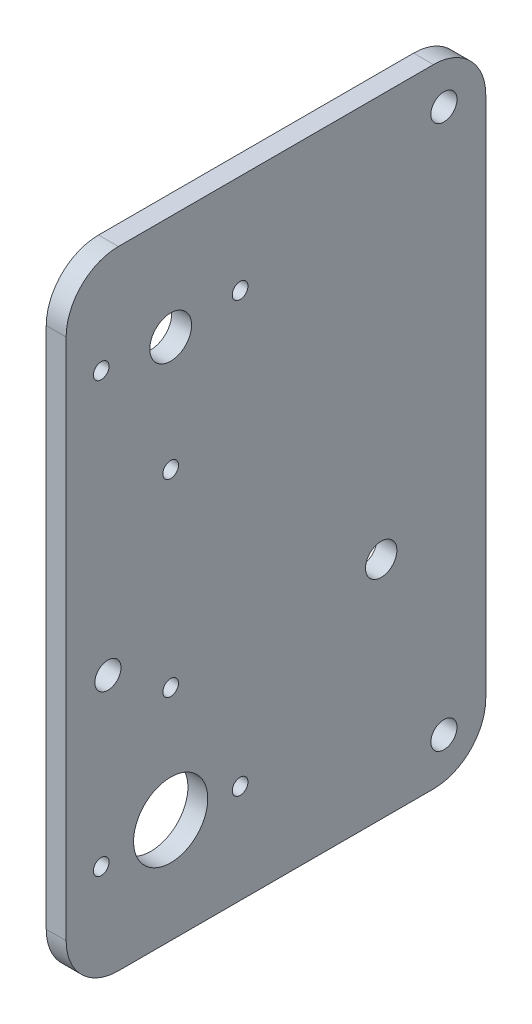
from build123d import *

# Parameters (mm, degrees)
SKETCH1_W           = 80.27017547
SKETCH1_H           = 120
SKETCH1_R           = 4
SKETCH1_R_2         = 7.1
SKETCH1_R_3         = 3
SKETCH1_R_4         = 2.5
SKETCH1_R_5         = 1.5
BOSS_EXTRUDE1_DEPTH = 3.8
FILLET1_R           = 10


with BuildPart() as part:
    # Sketch1 → Boss-Extrude1 (new body)
    with BuildSketch(Plane(origin=(0, 0, 0), x_dir=(0, 0, -1), z_dir=(1, 0, 0))):
        with Locations((22.195139842, -58.413555688)):
            Rectangle(SKETCH1_W, SKETCH1_H)
        with Locations((2.060052107, -18.413555688)):
            Circle(SKETCH1_R, mode=Mode.SUBTRACT)
        with Locations((2.060052107, -98.413555688)):
            Circle(SKETCH1_R_2, mode=Mode.SUBTRACT)
        with Locations((42.330227577, -75.364196313)):
            Circle(SKETCH1_R_3, mode=Mode.SUBTRACT)
        with Locations((54.330227577, -6.413555688)):
            Circle(SKETCH1_R_4, mode=Mode.SUBTRACT)
        with Locations((54.330227577, -110.413555688)):
            Circle(SKETCH1_R_4, mode=Mode.SUBTRACT)
        with Locations((-9.939947893, -68.413555688)):
            Circle(SKETCH1_R_4, mode=Mode.SUBTRACT)
        with Locations((2.060052107, -76.472881174)):
            Circle(SKETCH1_R_5, mode=Mode.SUBTRACT)
        with Locations((-11.225361719, -99.483892921)):
            Circle(SKETCH1_R_5, mode=Mode.SUBTRACT)
        with Locations((15.345465933, -99.483892921)):
            Circle(SKETCH1_R_5, mode=Mode.SUBTRACT)
        with Locations((15.345465933, -17.343218455)):
            Circle(SKETCH1_R_5, mode=Mode.SUBTRACT)
        with Locations((2.060052107, -40.354230201)):
            Circle(SKETCH1_R_5, mode=Mode.SUBTRACT)
        with Locations((-11.225361719, -17.343218455)):
            Circle(SKETCH1_R_5, mode=Mode.SUBTRACT)
    extrude(amount=BOSS_EXTRUDE1_DEPTH)

    # Fillet1
    fillet1_edges = [part.edges().sort_by_distance(p)[0] for p in [
        (1.9, 1.586444312, 17.939947893),
        (1.9, 1.586444312, -62.330227577),
        (1.9, -118.413555688, -62.330227577),
        (1.9, -118.413555688, 17.939947893),
    ]]
    fillet(fillet1_edges, radius=FILLET1_R)


solid = part.part
